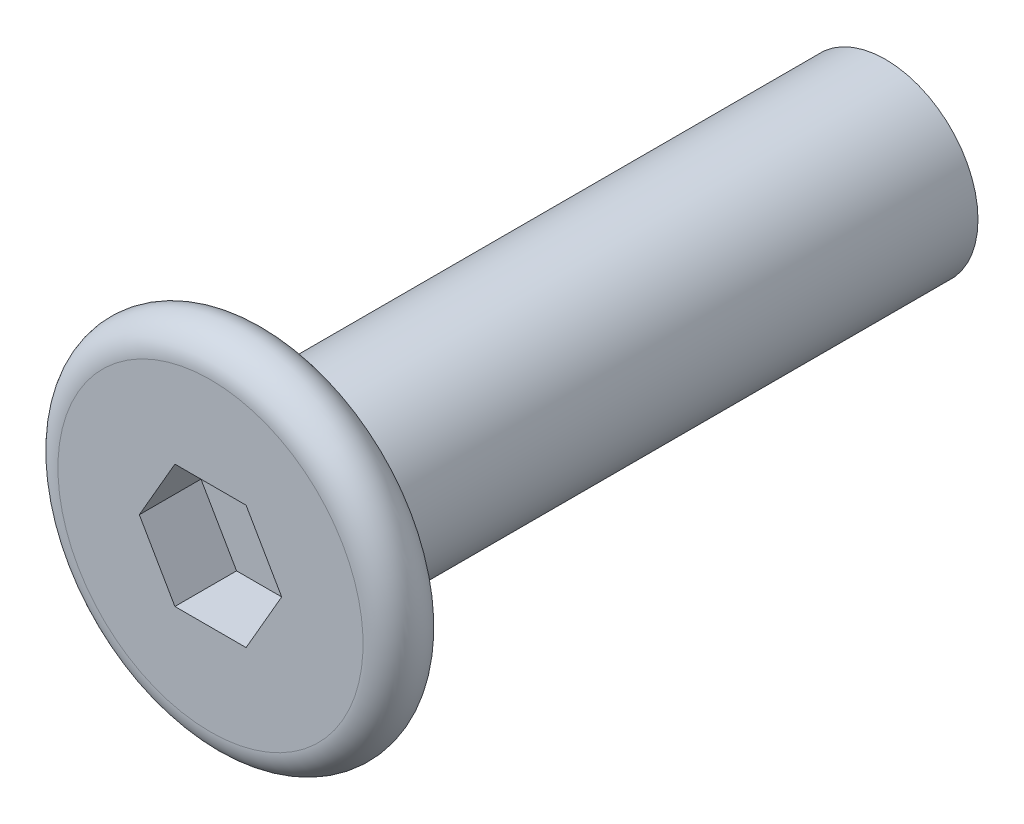
from build123d import *

# Parameters (mm, degrees)
FILLET_1_R          = 0.475
CUT_EXTRUDE_1_DEPTH = 1


with BuildPart() as part:
    # 草图1 → 旋转1 (revolve)
    with BuildSketch(Plane(origin=(0, 0, 0), x_dir=(0, 0, -1), z_dir=(1, 0, 0))):
        Polygon((0, 0), (0, 2.95), (0.95, 2.95), (0.95, 1.5), (10.95, 1.5), (10.95, 0), align=None)
    revolve(axis=Axis((0, 0, -10.95), (0, 0, 1)))

    # 圆角1
    fillet_1_edges = [part.edges().sort_by_distance(p)[0] for p in [
        (0, -2.95, -0.95),
        (0, -2.95, 0),
    ]]
    fillet(fillet_1_edges, radius=FILLET_1_R - 0.0001)  # a hair under: the kernel refuses the full size

    # 草图2 → 切除-拉伸1 (cut)
    with BuildSketch(Plane.XY):
        Polygon((0.577350269, 1), (-0.577350269, 1), (-1.154700538, 0), (-0.577350269, -1), (0.577350269, -1), (1.154700538, 0), align=None)
    extrude(amount=-CUT_EXTRUDE_1_DEPTH, mode=Mode.SUBTRACT)


solid = part.part
